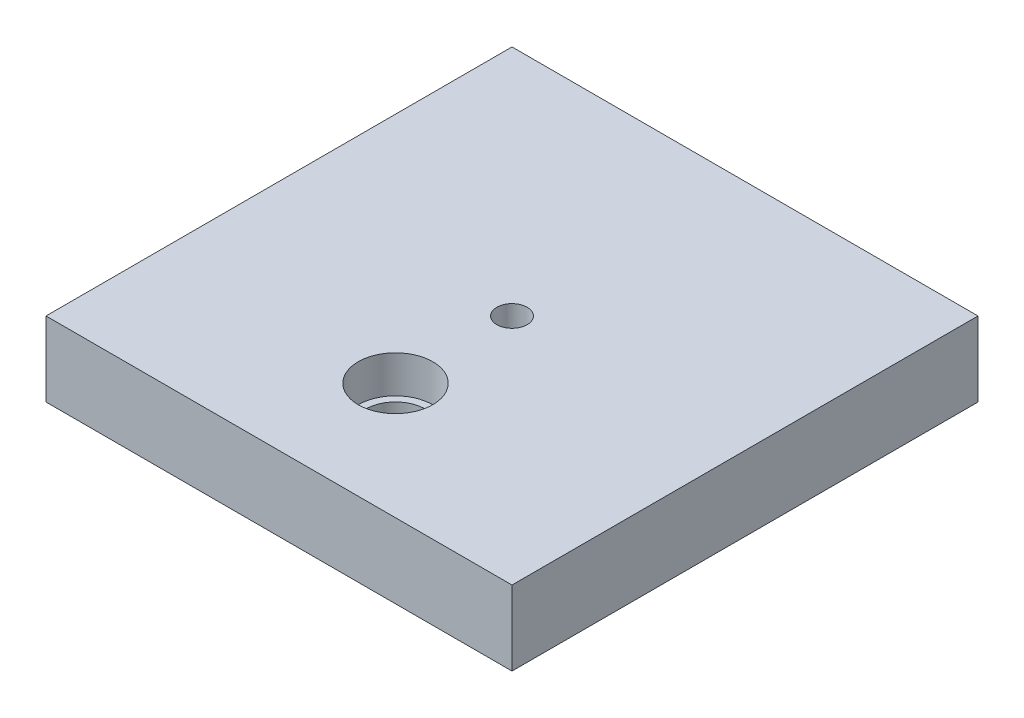
from build123d import *

# Parameters (mm, degrees)
SKETCH1_W           = 100
SKETCH1_H           = 100
SKETCH1_R           = 3.25
BOSS_EXTRUDE1_DEPTH = 16
SKETCH2_R           = 8
CUT_EXTRUDE1_DEPTH  = 8
CUT_EXTRUDE2_REACH  = 73.162
SKETCH3_R           = 6.4


with BuildPart() as part:
    # Sketch1 → Boss-Extrude1 (new body)
    with BuildSketch(Plane(origin=(0, 0, 0), x_dir=(1, 0, 0), z_dir=(0, 1, 0))):
        Rectangle(SKETCH1_W, SKETCH1_H)
        Circle(SKETCH1_R, mode=Mode.SUBTRACT)
    extrude(amount=BOSS_EXTRUDE1_DEPTH)

    # Sketch2 → Cut-Extrude1 (cut)
    with BuildSketch(Plane(origin=(0, 16, 0), x_dir=(1, 0, 0), z_dir=(0, 1, 0))):
        with Locations((0, -25)):
            Circle(SKETCH2_R)
    extrude(amount=-CUT_EXTRUDE1_DEPTH, mode=Mode.SUBTRACT)

    # Sketch3 → Cut-Extrude2 (cut, up to next)
    with BuildSketch(Plane(origin=(0, 8, 0), x_dir=(1, 0, 0), z_dir=(0, 1, 0)), mode=Mode.PRIVATE) as cut_extrude2_sk1:
        with Locations((0, -25)):
            Circle(SKETCH3_R)
    cut_extrude2_tool1 = extrude(cut_extrude2_sk1.sketch, amount=-CUT_EXTRUDE2_REACH, mode=Mode.PRIVATE) & part.part
    add(cut_extrude2_tool1.solids().sort_by_distance((0, 8, 25))[0], mode=Mode.SUBTRACT)


solid = part.part
